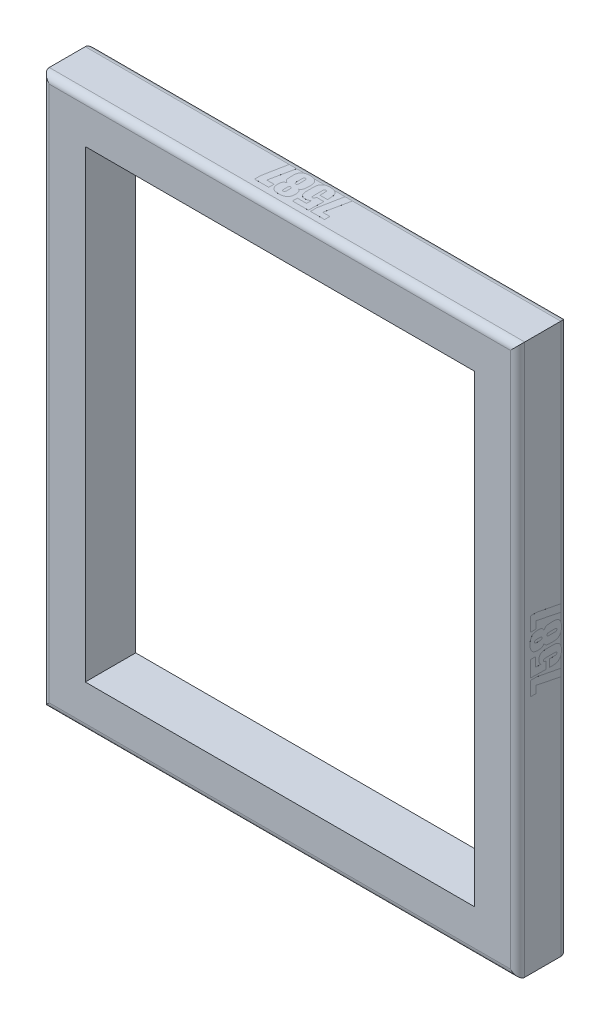
from build123d import *

# Parameters (mm, degrees)
SKETCH1_W           = 838.2
SKETCH1_H           = 969.899
SKETCH1_W_2         = 685.8
SKETCH1_H_2         = 817.499
BOSS_EXTRUDE1_DEPTH = 88.9
FILLET1_R           = 12.7
BOSS_EXTRUDE4_DEPTH = 0.0254
BOSS_EXTRUDE6_DEPTH = 0.0254
BOSS_EXTRUDE7_DEPTH = 0.0254
BOSS_EXTRUDE8_DEPTH = 0.0254


with BuildPart() as part:
    # Sketch1 → Boss-Extrude1 (new body)
    with BuildSketch(Plane.XY):
        with Locations((-393.7, 408.7495)):
            Rectangle(SKETCH1_W, SKETCH1_H)
        with Locations((-393.7, 408.7495)):
            Rectangle(SKETCH1_W_2, SKETCH1_H_2, mode=Mode.SUBTRACT)
    extrude(amount=-BOSS_EXTRUDE1_DEPTH)

    # Fillet1
    fillet1_edges = [part.edges().sort_by_distance(p)[0] for p in [
        (-812.8, 408.7495, -88.9),
        (-393.7, 893.699, -88.9),
        (-393.7, -76.2, -88.9),
        (25.4, 408.7495, -88.9),
        (25.4, 408.7495, 0),
        (-393.7, 893.699, 0),
        (-393.7, -76.2, 0),
        (-812.8, 408.7495, 0),
    ]]
    fillet(fillet1_edges, radius=FILLET1_R)

    # Sketch6 → Boss-Extrude4 (add)
    # profile 1 of 4: a face of its own
    with BuildSketch(Plane.XZ.offset(76.2)):
        Polygon((-424.557304831, -23.212708876), (-424.557304831, -34.277702022), (-432.661243474, -76.2), (-445.752221281, -76.2), (-436.713212795, -32.56340731), (-449.492500654, -32.56340731), (-449.492500654, -23.212708876), align=None)
    # profile 2 of 4: a face of its own
    with BuildSketch(Plane.XZ.offset(76.2)):
        with BuildLine():
            Line((-392.764930157, -23.212708876), (-392.764930157, -31.940027414))
            Line((-392.764930157, -31.940027414), (-408.972807442, -31.940027414))
            Line((-408.972807442, -31.940027414), (-408.972807442, -41.20306305))
            add(Edge.make_bspline(
                [(-408.972807442, -41.20306305), (-408.716075941, -40.911161607), (-408.212989606, -40.339156897), (-407.363386539, -39.59948061), (-406.476983186, -38.950610996), (-405.512639178, -38.449686845), (-404.504537755, -38.047478435), (-403.445088907, -37.748811018), (-402.325275851, -37.585699612), (-401.560929245, -37.562359109), (-401.170818436, -37.550446474)],
                knots=[0, 0, 0, 0, 1.045137506, 2.048032268, 3.025244095, 3.994689253, 4.963425262, 5.942900511, 6.950087905, 8, 8, 8, 8], degree=3))
            add(Edge.make_bspline(
                [(-401.170818436, -37.550446474), (-400.735493166, -37.560572296), (-399.888599593, -37.580271344), (-398.657572322, -37.710161958), (-397.512233318, -37.959944885), (-396.444043319, -38.283288733), (-395.464820631, -38.719671226), (-394.555737601, -39.230451526), (-393.748448308, -39.866074338), (-392.996444401, -40.580764758), (-392.344001839, -41.452215936), (-391.777156258, -42.483166997), (-391.319226704, -43.696673794), (-390.930326196, -45.074712041), (-390.633611279, -46.629495222), (-390.428265475, -48.357810092), (-390.285453474, -50.259181789), (-390.276223598, -51.5859422), (-390.271410574, -52.277796507)],
                knots=[0, 0, 0, 0, 0.985872992, 1.917944025, 2.797562931, 3.637028488, 4.440265023, 5.220874469, 5.991447987, 6.760933446, 7.563799771, 8.445720104, 9.41645382, 10.49401341, 11.685015475, 12.996358654, 14.433717056, 16, 16, 16, 16], degree=3))
            Line((-390.271410574, -52.277796507), (-390.271410574, -59.787576187))
            add(Edge.make_bspline(
                [(-390.271410574, -59.787576187), (-390.274412625, -60.238869043), (-390.280201015, -61.109027139), (-390.292535795, -62.369251199), (-390.345963876, -63.534721041), (-390.4052686, -64.609302477), (-390.464269231, -65.591480595), (-390.568713672, -66.480132886), (-390.669232784, -67.277361296), (-390.83721621, -68.21229513), (-391.121111981, -69.299467562), (-391.615369367, -70.542019338), (-392.263373144, -71.734601638), (-393.057409371, -72.873428682), (-394.015185194, -73.928491163), (-395.159749376, -74.845926401), (-396.46992809, -75.63960778), (-397.94773342, -76.301622987), (-399.599236299, -76.816037958), (-401.420725619, -77.179374827), (-403.411991544, -77.404169059), (-404.796835288, -77.432215352), (-405.514997083, -77.446759791)],
                knots=[0, 0, 0, 0, 0.989754807, 1.908390848, 2.7635747, 3.547977914, 4.268858805, 4.920711554, 5.509810583, 6.030765573, 7.003130656, 7.968352344, 8.956004724, 9.973318671, 11.006457242, 12.069562088, 13.178372901, 14.357538766, 15.611873537, 16.963616047, 18.425371121, 20, 20, 20, 20], degree=3))
            add(Edge.make_bspline(
                [(-405.514997083, -77.446759791), (-406.327771929, -77.423696733), (-407.91162227, -77.378753864), (-410.216221496, -77.047243869), (-412.372770161, -76.481238427), (-414.055266204, -75.823258393), (-415.301939745, -75.184766025), (-416.162224394, -74.651314239), (-416.946222207, -74.048742685), (-417.668176531, -73.401879218), (-418.311404083, -72.690376618), (-418.907222088, -71.942274062), (-419.407130848, -71.118609389), (-419.854704413, -70.238104289), (-420.241278938, -69.268096101), (-420.551258746, -68.181756329), (-420.84022698, -66.981343604), (-421.056402906, -65.652363449), (-421.22959408, -64.202944467), (-421.357283395, -62.633737406), (-421.41949466, -60.943929123), (-421.433270418, -59.777875526), (-421.440405353, -59.173936602)],
                knots=[0, 0, 0, 0, 1.727950145, 3.367247941, 4.937991842, 6.459754912, 7.197724692, 7.914163588, 8.608713051, 9.29788901, 9.972208411, 10.646138941, 11.328189198, 12.016707826, 12.744892405, 13.544369189, 14.416825977, 15.369082158, 16.405235107, 17.52037283, 18.715716525, 20, 20, 20, 20], degree=3))
            Line((-421.440405353, -59.173936602), (-421.440405353, -56.251843342))
            Line((-421.440405353, -56.251843342), (-408.349427546, -56.251843342))
            Line((-408.349427546, -56.251843342), (-408.349427546, -59.641471524))
            add(Edge.make_bspline(
                [(-408.349427546, -59.641471524), (-408.345719237, -60.063543871), (-408.338559332, -60.878469966), (-408.335677154, -62.05402751), (-408.303192341, -63.135195908), (-408.265820669, -64.1191072), (-408.217561517, -65.005613589), (-408.160419045, -65.798151324), (-408.091232831, -66.496217071), (-408.022620618, -67.107009795), (-407.907196172, -67.634534221), (-407.742516196, -68.088113051), (-407.528591411, -68.478355815), (-407.250463986, -68.79894568), (-406.914354786, -69.040832504), (-406.534114093, -69.226510605), (-406.093781561, -69.317704752), (-405.784799631, -69.334159029), (-405.622140503, -69.342821149)],
                knots=[0, 0, 0, 0, 1.823732709, 3.521214749, 5.07892445, 6.496893277, 7.775393918, 8.9147992, 9.929598955, 10.806563962, 11.568882902, 12.256841855, 12.884990135, 13.481481553, 14.073502327, 14.663358483, 15.296344146, 16, 16, 16, 16], degree=3))
            add(Edge.make_bspline(
                [(-405.622140503, -69.342821149), (-405.471912789, -69.335904639), (-405.179568203, -69.322445045), (-404.769249364, -69.202677213), (-404.398989176, -69.013447494), (-404.00415427, -68.652305625), (-403.623800721, -68.127802624), (-403.464829962, -67.549210427), (-403.461420465, -67.089367955), (-403.433295375, -66.687313598), (-403.431066642, -66.134958148), (-403.422013427, -65.433646231), (-403.396035967, -64.583189124), (-403.395169872, -63.582957594), (-403.367261666, -62.437042159), (-403.364076204, -61.622021218), (-403.362388381, -61.190180952)],
                knots=[0, 0, 0, 0, 0.670460052, 1.304721758, 1.895793995, 2.513210904, 3.681360763, 4.748587252, 5.126397419, 5.736946296, 6.550219692, 7.595791071, 8.873918375, 10.355072828, 12.068728984, 14, 14, 14, 14], degree=3))
            Line((-403.362388381, -61.190180952), (-403.362388381, -50.758308012))
            add(Edge.make_bspline(
                [(-403.362388381, -50.758308012), (-403.369593757, -50.303588843), (-403.382793637, -49.470566535), (-403.480077684, -48.338076136), (-403.653498813, -47.438533211), (-403.909653701, -46.745585738), (-404.283061169, -46.249037086), (-404.735862368, -45.884057111), (-405.309527927, -45.690937481), (-405.718252561, -45.667007013), (-405.933830451, -45.654385117)],
                knots=[0, 0, 0, 0, 1.685864163, 3.088417099, 4.207402662, 5.076902269, 5.799120759, 6.485333904, 7.201103886, 8, 8, 8, 8], degree=3))
            add(Edge.make_bspline(
                [(-405.933830451, -45.654385117), (-406.073979291, -45.659095977), (-406.34818563, -45.668312949), (-406.742745462, -45.7669057), (-407.099367581, -45.938230081), (-407.512578844, -46.22605672), (-407.906791866, -46.66636358), (-408.191004879, -47.194645083), (-408.261649994, -47.734734037), (-408.324555601, -48.321253834), (-408.343122206, -49.105777274), (-408.347184064, -49.693453639), (-408.349427546, -50.018044386)],
                knots=[0, 0, 0, 0, 0.735055358, 1.438162732, 2.117072139, 2.803012647, 4.070557493, 5.191645157, 5.884125613, 6.912400264, 8.294628872, 10, 10, 10, 10], degree=3))
            Line((-408.349427546, -50.018044386), (-421.440405353, -50.018044386))
            Line((-421.440405353, -50.018044386), (-420.817025458, -23.212708876))
            Line((-420.817025458, -23.212708876), (-392.764930157, -23.212708876))
        make_face()
    # profile 3 of 4: a face of its own
    with BuildSketch(Plane.XZ.offset(76.2)):
        with BuildLine():
            add(Edge.make_bspline(
                [(-359.852419732, -46.58945496), (-359.413585941, -46.794102682), (-358.549637361, -47.197000345), (-357.39546286, -48.012376105), (-356.410010904, -48.978472514), (-355.683250848, -49.897517746), (-355.211301504, -50.811292425), (-354.922841845, -51.706861748), (-354.675991926, -52.796404663), (-354.461649804, -54.080522928), (-354.316303052, -55.567900372), (-354.201754485, -57.253698057), (-354.119651658, -59.140684774), (-354.11684709, -60.466056129), (-354.115376631, -61.160960019)],
                knots=[0, 0, 0, 0, 1.032863208, 2.033436625, 2.999672589, 3.9748283, 4.520758756, 5.187511175, 5.978195588, 6.906317789, 7.966347498, 9.169082625, 10.515725053, 12, 12, 12, 12], degree=3))
            add(Edge.make_bspline(
                [(-354.115376631, -61.160960019), (-354.118913329, -61.674005032), (-354.125765338, -62.667980084), (-354.183796952, -64.103820002), (-354.280183874, -65.435815896), (-354.413901274, -66.66448171), (-354.589484596, -67.788315856), (-354.788144707, -68.812038252), (-355.04000596, -69.726796939), (-355.336608902, -70.550492599), (-355.67881948, -71.309018255), (-356.10612767, -72.011170672), (-356.590329201, -72.689024305), (-357.163103397, -73.320562442), (-357.798454233, -73.929374639), (-358.509758007, -74.501289288), (-359.293399147, -75.04017453), (-360.149904015, -75.534912741), (-361.083170377, -75.986497091), (-362.091272349, -76.384062017), (-363.176015415, -76.715170959), (-364.336637162, -76.974211096), (-365.568292093, -77.188055959), (-366.878238077, -77.344956513), (-368.263634882, -77.430364051), (-369.212745212, -77.441198853), (-369.69987402, -77.446759791)],
                knots=[0, 0, 0, 0, 1.398583789, 2.709620715, 3.916618244, 5.038718275, 6.077731848, 7.016823425, 7.880065367, 8.661220812, 9.401808779, 10.144087346, 10.898301765, 11.669363034, 12.464435054, 13.295212249, 14.15449737, 15.054744736, 15.988985256, 16.978448116, 18.005975078, 19.077395418, 20.218224661, 21.412695174, 22.672071436, 24, 24, 24, 24], degree=3))
            add(Edge.make_bspline(
                [(-369.69987402, -77.446759791), (-370.174053488, -77.441503254), (-371.097287346, -77.431268704), (-372.442939675, -77.341861974), (-373.711540433, -77.199808417), (-374.90324735, -76.99043543), (-376.026654445, -76.747615488), (-377.067721564, -76.419394986), (-378.040941239, -76.05687962), (-378.929154093, -75.612817835), (-379.746802265, -75.12200953), (-380.511555813, -74.606583761), (-381.21872322, -74.050674339), (-381.854509737, -73.448412652), (-382.44011409, -72.816393903), (-382.966907106, -72.148745446), (-383.420749146, -71.432964934), (-383.837433143, -70.678366318), (-384.17778712, -69.829695849), (-384.479506255, -68.873086589), (-384.729266825, -67.788127109), (-384.928078531, -66.577220491), (-385.095526807, -65.238877596), (-385.207292915, -63.772964785), (-385.276614981, -62.181130169), (-385.281721388, -61.079869578), (-385.28437141, -60.508359191)],
                knots=[0, 0, 0, 0, 1.268974087, 2.470709768, 3.607874871, 4.683617739, 5.708163252, 6.681184595, 7.602668945, 8.484841014, 9.334307608, 10.153776327, 10.951769698, 11.738661753, 12.495071084, 13.256455536, 14.010915677, 14.761311323, 15.560108623, 16.453296839, 17.443968622, 18.536843119, 19.736471951, 21.052764021, 22.470501904, 24, 24, 24, 24], degree=3))
            add(Edge.make_bspline(
                [(-385.28437141, -60.508359191), (-385.279226346, -59.738645817), (-385.269274631, -58.249846521), (-385.127250324, -56.095256859), (-384.914612793, -54.09961998), (-384.680984729, -52.531610578), (-384.386535104, -51.36034273), (-384.072855162, -50.540142343), (-383.672745539, -49.762291945), (-383.168243412, -49.035614416), (-382.569679368, -48.353894585), (-381.88604633, -47.710146664), (-381.112277467, -47.108489834), (-380.5414724, -46.765447118), (-380.248630691, -46.58945496)],
                knots=[0, 0, 0, 0, 1.76788096, 3.419480574, 4.957221844, 6.378326448, 7.056708483, 7.727130868, 8.390966019, 9.061263932, 9.753766915, 10.471320765, 11.215737443, 12, 12, 12, 12], degree=3))
            add(Edge.make_bspline(
                [(-380.248630691, -46.58945496), (-380.651031886, -46.373423135), (-381.450099441, -45.944438271), (-382.480993805, -45.042456456), (-383.358632205, -43.976346239), (-384.078496451, -42.730124608), (-384.613840443, -41.298912841), (-385.015356892, -39.699046673), (-385.243029842, -37.920597805), (-385.270221799, -36.677708203), (-385.28437141, -36.030957979)],
                knots=[0, 0, 0, 0, 0.883452064, 1.754313577, 2.635585967, 3.552582121, 4.531408869, 5.589827807, 6.745842426, 8, 8, 8, 8], degree=3))
            add(Edge.make_bspline(
                [(-385.28437141, -36.030957979), (-385.274954736, -35.462195026), (-385.256712902, -34.360396344), (-385.064632528, -32.761034378), (-384.768367242, -31.270623142), (-384.354528958, -29.885805214), (-383.799926612, -28.619081076), (-383.143173544, -27.450393201), (-382.343545324, -26.402041154), (-381.431215136, -25.456629554), (-380.393134099, -24.626176928), (-379.232337507, -23.913095828), (-377.957831386, -23.309201617), (-376.565956083, -22.809058021), (-375.05025833, -22.436201844), (-373.418785741, -22.166298974), (-371.667636814, -21.998721399), (-370.460005355, -21.977111204), (-369.836238372, -21.965949085)],
                knots=[0, 0, 0, 0, 1.139402086, 2.207231867, 3.22303984, 4.18224988, 5.097340406, 5.98918555, 6.862439802, 7.732171629, 8.616292135, 9.519178424, 10.456373729, 11.438161639, 12.478190297, 13.58003508, 14.750037352, 16, 16, 16, 16], degree=3))
            add(Edge.make_bspline(
                [(-369.836238372, -21.965949085), (-369.121552229, -21.976152166), (-367.748298999, -21.995757157), (-365.772776293, -22.17235312), (-363.967440118, -22.457355795), (-362.332328938, -22.86237432), (-360.869409943, -23.384193826), (-359.579157079, -24.029851148), (-358.453701508, -24.788153544), (-357.506077666, -25.683184673), (-356.704050268, -26.681096088), (-356.007504737, -27.768477757), (-355.422798653, -28.959641298), (-354.933330521, -30.245907568), (-354.566759264, -31.637792434), (-354.310244148, -33.124115808), (-354.135389151, -34.708627918), (-354.122180914, -35.79993614), (-354.115376631, -36.362128548)],
                knots=[0, 0, 0, 0, 1.390282688, 2.671396681, 3.855329736, 4.943140366, 5.94429892, 6.870936351, 7.743522199, 8.574793464, 9.396625976, 10.229000645, 11.082185822, 11.973862168, 12.902457006, 13.877689888, 14.906682267, 16, 16, 16, 16], degree=3))
            add(Edge.make_bspline(
                [(-354.115376631, -36.362128548), (-354.119847695, -36.716069238), (-354.128507009, -37.401562372), (-354.173828378, -38.389707737), (-354.260571453, -39.303374453), (-354.386509067, -40.135369978), (-354.540447374, -40.894415369), (-354.73168902, -41.576659915), (-354.965996945, -42.181958593), (-355.32561953, -42.913806345), (-355.970708581, -43.768744031), (-356.998060665, -44.731094828), (-358.307217861, -45.699111995), (-359.313178246, -46.278744837), (-359.852419732, -46.58945496)],
                knots=[0, 0, 0, 0, 1.011071591, 1.958188627, 2.824730267, 3.631383318, 4.36076049, 5.035941548, 5.65252725, 6.212453826, 7.360711157, 8.68567436, 10.223367527, 12, 12, 12, 12], degree=3))
        make_face()
        with BuildLine():
            add(Edge.make_bspline(
                [(-367.206354438, -34.638093525), (-367.210167817, -34.215848653), (-367.217132739, -33.444642203), (-367.306783048, -32.403735528), (-367.459974611, -31.592436044), (-367.687118088, -30.98155937), (-368.039725522, -30.551996084), (-368.501562921, -30.259006447), (-369.086029545, -30.099881266), (-369.510603455, -30.080373971), (-369.738835264, -30.069887727)],
                knots=[0, 0, 0, 0, 1.677591877, 3.064026972, 4.144413779, 4.954209473, 5.623204291, 6.313866106, 7.09361037, 8, 8, 8, 8], degree=3))
            add(Edge.make_bspline(
                [(-369.738835264, -30.069887727), (-369.961246616, -30.07813553), (-370.376326953, -30.093528182), (-370.942528621, -30.282381675), (-371.395716553, -30.593032725), (-371.728406796, -31.052628019), (-371.94636359, -31.675067746), (-372.08729225, -32.479940593), (-372.184198585, -33.489713219), (-372.190141764, -34.231966187), (-372.193393603, -34.638093525)],
                knots=[0, 0, 0, 0, 0.893586732, 1.667676933, 2.372236962, 3.073872481, 3.915008431, 5.008641075, 6.36326335, 8, 8, 8, 8], degree=3))
            Line((-372.193393603, -34.638093525), (-372.193393603, -38.797206265))
            add(Edge.make_bspline(
                [(-372.193393603, -38.797206265), (-372.186522435, -39.177380053), (-372.173863169, -39.877802598), (-372.071112553, -40.83397162), (-371.909639832, -41.605461104), (-371.658880933, -42.206501342), (-371.29391583, -42.642542693), (-370.840238482, -42.959242866), (-370.276306962, -43.131031073), (-369.873035797, -43.150581758), (-369.660912777, -43.160865534)],
                knots=[0, 0, 0, 0, 1.580112676, 2.911159526, 3.99162225, 4.849527291, 5.587451052, 6.3250044, 7.118942395, 8, 8, 8, 8], degree=3))
            add(Edge.make_bspline(
                [(-369.660912777, -43.160865534), (-369.438580836, -43.151914515), (-369.024670316, -43.135250598), (-368.461950208, -42.956797327), (-368.002357605, -42.668595802), (-367.666903773, -42.212621467), (-367.450897438, -41.575176113), (-367.310801006, -40.727966927), (-367.21522748, -39.640204651), (-367.209508394, -38.83317384), (-367.206354438, -38.388113209)],
                knots=[0, 0, 0, 0, 0.861738235, 1.604279261, 2.26950699, 2.936050938, 3.759007418, 4.863263716, 6.270155474, 8, 8, 8, 8], degree=3))
            Line((-367.206354438, -38.388113209), (-367.206354438, -34.638093525))
        make_face(mode=Mode.SUBTRACT)
        with BuildLine():
            add(Edge.make_bspline(
                [(-367.206354438, -56.972626346), (-367.211748628, -56.504657885), (-367.221584142, -55.651386075), (-367.337433584, -54.501977875), (-367.499096936, -53.596117351), (-367.775560823, -52.922809224), (-368.143206249, -52.439210606), (-368.607226602, -52.115529202), (-369.15774369, -51.911559219), (-369.558358338, -51.896215562), (-369.768056196, -51.888184072)],
                knots=[0, 0, 0, 0, 1.738659472, 3.170190386, 4.292187352, 5.146388336, 5.851388248, 6.517831636, 7.224173325, 8, 8, 8, 8], degree=3))
            add(Edge.make_bspline(
                [(-369.768056196, -51.888184072), (-369.97116903, -51.896599966), (-370.35480661, -51.912495824), (-370.883148731, -52.107330947), (-371.321330113, -52.420202549), (-371.677922238, -52.884607234), (-371.912710819, -53.557212561), (-372.075614559, -54.458975986), (-372.173942067, -55.6264714), (-372.186494539, -56.495172595), (-372.193393603, -56.972626346)],
                knots=[0, 0, 0, 0, 0.760444209, 1.436319754, 2.083469305, 2.762315263, 3.601134717, 4.733605304, 6.204730916, 8, 8, 8, 8], degree=3))
            Line((-372.193393603, -56.972626346), (-372.193393603, -63.897987373))
            add(Edge.make_bspline(
                [(-372.193393603, -63.897987373), (-372.191737262, -64.173996507), (-372.188579438, -64.700209827), (-372.159328024, -65.450525857), (-372.113123307, -66.123390099), (-372.043258696, -66.720891139), (-371.965870154, -67.244546297), (-371.840721114, -67.686884709), (-371.725336992, -68.057860706), (-371.530595153, -68.435558786), (-371.218349229, -68.805624502), (-370.749595124, -69.123064419), (-370.18832195, -69.318121442), (-369.785972323, -69.334278767), (-369.573249979, -69.342821149)],
                knots=[0, 0, 0, 0, 1.447752538, 2.760150215, 3.93838463, 4.984106116, 5.916477053, 6.709663222, 7.393673362, 7.949736311, 8.928845415, 9.89723076, 10.888265397, 12, 12, 12, 12], degree=3))
            add(Edge.make_bspline(
                [(-369.573249979, -69.342821149), (-369.357037119, -69.335561668), (-368.952954179, -69.321994332), (-368.405391908, -69.119990806), (-367.969939686, -68.794225036), (-367.711683355, -68.410738316), (-367.562786825, -68.027964827), (-367.467603375, -67.654896532), (-367.397279721, -67.200599882), (-367.311452571, -66.673174845), (-367.273077674, -66.063790055), (-367.228778199, -65.379113387), (-367.214653339, -64.615555538), (-367.20919766, -64.079795235), (-367.206354438, -63.800584265)],
                knots=[0, 0, 0, 0, 1.132013677, 2.115634625, 3.017552291, 3.950947162, 4.502860332, 5.17404829, 5.971581461, 6.920938255, 7.983416076, 9.181056498, 10.530910287, 12, 12, 12, 12], degree=3))
            Line((-367.206354438, -63.800584265), (-367.206354438, -56.972626346))
        make_face(mode=Mode.SUBTRACT)
    # profile 4 of 4: a face of its own
    with BuildSketch(Plane.XZ.offset(76.2)):
        Polygon((-326.06328133, -23.212708876), (-326.06328133, -34.277702022), (-334.167219972, -76.2), (-347.258197779, -76.2), (-338.219189294, -32.56340731), (-350.998477153, -32.56340731), (-350.998477153, -23.212708876), align=None)
    extrude(amount=BOSS_EXTRUDE4_DEPTH)

    # Sketch9 → Boss-Extrude6 (add)
    # profile 1 of 4: a face of its own
    with BuildSketch(Plane(origin=(0, 893.699, 0), x_dir=(1, 0, 0), z_dir=(0, 1, 0))):
        Polygon((-362.842695169, 23.212708876), (-362.842695169, 34.277702022), (-354.738756526, 76.2), (-341.647778719, 76.2), (-350.686787205, 32.56340731), (-337.907499346, 32.56340731), (-337.907499346, 23.212708876), align=None)
    # profile 2 of 4: a face of its own
    with BuildSketch(Plane(origin=(0, 893.699, 0), x_dir=(1, 0, 0), z_dir=(0, 1, 0))):
        with BuildLine():
            Line((-394.635069843, 23.212708876), (-394.635069843, 31.940027414))
            Line((-394.635069843, 31.940027414), (-378.427192558, 31.940027414))
            Line((-378.427192558, 31.940027414), (-378.427192558, 41.20306305))
            add(Edge.make_bspline(
                [(-378.427192558, 41.20306305), (-378.683924059, 40.911161607), (-379.187010395, 40.339156897), (-380.036613461, 39.59948061), (-380.923016814, 38.950610996), (-381.887360822, 38.449686845), (-382.895462245, 38.047478435), (-383.954911093, 37.748811018), (-385.074724149, 37.585699612), (-385.839070755, 37.562359109), (-386.229181564, 37.550446474)],
                knots=[0, 0, 0, 0, 1.045137506, 2.048032268, 3.025244095, 3.994689253, 4.963425262, 5.942900511, 6.950087905, 8, 8, 8, 8], degree=3))
            add(Edge.make_bspline(
                [(-386.229181564, 37.550446474), (-386.664733125, 37.558999433), (-387.512438267, 37.575645882), (-388.740064019, 37.727141616), (-389.886847352, 37.953623248), (-390.950227936, 38.289704751), (-391.936768455, 38.713866841), (-392.837838177, 39.24351223), (-393.655196602, 39.864324093), (-394.402935363, 40.581638), (-395.056185322, 41.451952428), (-395.622785968, 42.483248337), (-396.080791315, 43.696648425), (-396.469668192, 45.074719943), (-396.766390459, 46.629492776), (-396.971733993, 48.357810842), (-397.114546678, 50.259181574), (-397.123776454, 51.585942126), (-397.128589426, 52.277796507)],
                knots=[0, 0, 0, 0, 0.985978896, 1.918990669, 2.797197047, 3.629736286, 4.43979477, 5.224184376, 5.990372855, 6.759940973, 7.562893544, 8.444908613, 9.415746607, 10.49342195, 11.684551954, 12.996035999, 14.433548803, 16, 16, 16, 16], degree=3))
            Line((-397.128589426, 52.277796507), (-397.128589426, 59.787576187))
            add(Edge.make_bspline(
                [(-397.128589426, 59.787576187), (-397.125576323, 60.238867878), (-397.119766624, 61.109023726), (-397.107579484, 62.369263354), (-397.053649962, 63.534680324), (-396.995999522, 64.609436191), (-396.931605467, 65.590706865), (-396.844987655, 66.477663458), (-396.738935959, 67.270684447), (-396.572878828, 68.202549632), (-396.288719666, 69.294295949), (-395.787174644, 70.535574688), (-395.134547146, 71.727063054), (-394.339654162, 72.864172872), (-393.388366312, 73.928509909), (-392.239787429, 74.845548167), (-390.930166593, 75.639504169), (-389.452404029, 76.302530694), (-387.799412274, 76.812349409), (-385.981392505, 77.195841231), (-383.987041568, 77.399548484), (-382.602956069, 77.430634728), (-381.885002917, 77.446759791)],
                knots=[0, 0, 0, 0, 0.98969914, 1.908283515, 2.763419269, 3.547778367, 4.268618713, 4.919695537, 5.50170546, 6.022631151, 6.994941545, 7.969361217, 8.950701588, 9.967958318, 11.006300459, 12.069345513, 13.178093963, 14.357193509, 15.611457733, 16.964567375, 18.425459682, 20, 20, 20, 20], degree=3))
            add(Edge.make_bspline(
                [(-381.885002917, 77.446759791), (-381.072363855, 77.423078257), (-379.485564616, 77.376836523), (-377.178210921, 77.053246545), (-375.026070383, 76.466634058), (-373.344900459, 75.813624192), (-372.097592311, 75.175579205), (-371.241224027, 74.640294678), (-370.450421278, 74.049843494), (-369.732895798, 73.400801245), (-369.087554816, 72.69375941), (-368.503663225, 71.938839689), (-368.002239201, 71.119018468), (-367.554284741, 70.238230093), (-367.171891345, 69.266179999), (-366.841772591, 68.185286601), (-366.577230426, 66.978345715), (-366.338372639, 65.653936181), (-366.171993171, 64.202637299), (-366.042246286, 62.633828423), (-365.980636829, 60.943903677), (-365.966774447, 59.777866844), (-365.959594647, 59.173936602)],
                knots=[0, 0, 0, 0, 1.728367873, 3.374896622, 4.941126004, 6.463256957, 7.201405138, 7.918017232, 8.608569322, 9.297911888, 9.972394304, 10.642265426, 11.324480566, 12.013165642, 12.741526258, 13.543191508, 14.414300458, 15.367962646, 16.404366083, 17.519773387, 18.715406053, 20, 20, 20, 20], degree=3))
            Line((-365.959594647, 59.173936602), (-365.959594647, 56.251843342))
            Line((-365.959594647, 56.251843342), (-379.050572454, 56.251843342))
            Line((-379.050572454, 56.251843342), (-379.050572454, 59.641471524))
            add(Edge.make_bspline(
                [(-379.050572454, 59.641471524), (-379.05428457, 60.063543486), (-379.061451825, 60.878468837), (-379.064283197, 62.054031522), (-379.096937965, 63.135182722), (-379.133758024, 64.119149833), (-379.183780165, 65.005477822), (-379.23517529, 65.795692915), (-379.321089629, 66.489160407), (-379.389494326, 67.09618337), (-379.493259529, 67.627891496), (-379.652765125, 68.089381726), (-379.883710251, 68.47195165), (-380.148455299, 68.80243365), (-380.486395026, 69.040233336), (-380.86567062, 69.226682639), (-381.306281084, 69.317654693), (-381.615221974, 69.334141765), (-381.777859497, 69.342821149)],
                knots=[0, 0, 0, 0, 1.824236655, 3.522187753, 5.080327891, 6.49868854, 7.777542464, 8.917262594, 9.919851397, 10.797058732, 11.556612963, 12.257940989, 12.893274711, 13.48078562, 14.072969985, 14.662989134, 15.296149708, 16, 16, 16, 16], degree=3))
            add(Edge.make_bspline(
                [(-381.777859497, 69.342821149), (-381.928026284, 69.335800998), (-382.220252306, 69.322139717), (-382.635666084, 69.202563038), (-383.006351175, 69.004930161), (-383.406012715, 68.645593198), (-383.774204552, 68.114351447), (-383.935450278, 67.539623534), (-383.938382646, 67.082828558), (-383.967268141, 66.680859635), (-383.968615873, 66.131696816), (-383.978210849, 65.430406488), (-384.003921278, 64.583187234), (-384.004844304, 63.58295822), (-384.03273402, 62.437041969), (-384.035922302, 61.622021152), (-384.037611619, 61.190180952)],
                knots=[0, 0, 0, 0, 0.670608384, 1.305010414, 1.915867048, 2.533420554, 3.693585531, 4.761048132, 5.138941885, 5.735119042, 6.563093728, 7.594374212, 8.872784286, 10.354266428, 12.068301712, 14, 14, 14, 14], degree=3))
            Line((-384.037611619, 61.190180952), (-384.037611619, 50.758308012))
            add(Edge.make_bspline(
                [(-384.037611619, 50.758308012), (-384.03071449, 50.303529465), (-384.018128325, 49.473630846), (-383.917714463, 48.341847455), (-383.74832791, 47.441037791), (-383.489519493, 46.746707725), (-383.120379011, 46.247329875), (-382.658570596, 45.897557313), (-382.093264415, 45.687163837), (-381.682325076, 45.665683729), (-381.466169549, 45.654385117)],
                knots=[0, 0, 0, 0, 1.686577367, 3.07773583, 4.208985325, 5.078852773, 5.801376797, 6.48055365, 7.200765913, 8, 8, 8, 8], degree=3))
            add(Edge.make_bspline(
                [(-381.466169549, 45.654385117), (-381.325983314, 45.659048286), (-381.05170381, 45.668171948), (-380.657668453, 45.76743358), (-380.301544405, 45.935178652), (-379.89737939, 46.233622598), (-379.490871254, 46.657195191), (-379.222012538, 47.19426346), (-379.134646609, 47.730043727), (-379.07717666, 48.321647914), (-379.056260344, 49.105636808), (-379.052596243, 49.69340366), (-379.050572454, 50.018044386)],
                knots=[0, 0, 0, 0, 0.735446102, 1.438927237, 2.118197541, 2.790575895, 4.070333913, 5.169206575, 5.881937678, 6.910758944, 8.293722323, 10, 10, 10, 10], degree=3))
            Line((-379.050572454, 50.018044386), (-365.959594647, 50.018044386))
            Line((-365.959594647, 50.018044386), (-366.582974542, 23.212708876))
            Line((-366.582974542, 23.212708876), (-394.635069843, 23.212708876))
        make_face()
    # profile 3 of 4: a face of its own
    with BuildSketch(Plane(origin=(0, 893.699, 0), x_dir=(1, 0, 0), z_dir=(0, 1, 0))):
        with BuildLine():
            add(Edge.make_bspline(
                [(-427.547580268, 46.58945496), (-427.986990482, 46.793342558), (-428.849663924, 47.193625505), (-429.995730026, 48.018994395), (-430.990498094, 48.974477537), (-431.716474884, 49.89781767), (-432.188767394, 50.811217082), (-432.477134144, 51.706888006), (-432.724016265, 52.796395706), (-432.938347496, 54.080525882), (-433.083697823, 55.567899415), (-433.198245237, 57.253698361), (-433.280348423, 59.140684685), (-433.283152938, 60.466056098), (-433.284623369, 61.160960019)],
                knots=[0, 0, 0, 0, 1.032921266, 2.027885824, 2.999166675, 3.9743772, 4.520338343, 5.187128241, 5.977857099, 6.90603147, 7.966120764, 9.168923498, 10.515641621, 12, 12, 12, 12], degree=3))
            add(Edge.make_bspline(
                [(-433.284623369, 61.160960019), (-433.281123898, 61.674011343), (-433.274344012, 62.667998621), (-433.215810724, 64.103753497), (-433.121120767, 65.436037053), (-432.982152337, 66.660068861), (-432.82542826, 67.787231478), (-432.607919945, 68.803110881), (-432.371287478, 69.721520111), (-432.072609699, 70.540718455), (-431.730407785, 71.298797536), (-431.305220002, 72.005058792), (-430.805437438, 72.676614485), (-430.240662369, 73.320390073), (-429.604040555, 73.929550059), (-428.886874625, 74.490420647), (-428.107465223, 75.031890858), (-427.247095976, 75.522260004), (-426.321837432, 75.991269993), (-425.30610021, 76.371379158), (-424.223010029, 76.703594269), (-423.064791914, 76.97736141), (-421.831505104, 77.187110482), (-420.521820299, 77.345228662), (-419.136349255, 77.430290097), (-418.187249408, 77.44117377), (-417.70012598, 77.446759791)],
                knots=[0, 0, 0, 0, 1.398670318, 2.709788357, 3.916860561, 5.039030015, 6.068030165, 7.017633598, 7.870060263, 8.651264037, 9.391897823, 10.134222314, 10.893711138, 11.671447011, 12.466568221, 13.291861523, 14.151199807, 15.051502871, 15.989692636, 16.976004672, 18.003595206, 19.077090862, 20.217990687, 21.4125351, 22.671989278, 24, 24, 24, 24], degree=3))
            add(Edge.make_bspline(
                [(-417.70012598, 77.446759791), (-417.225960764, 77.441440315), (-416.302754656, 77.431083223), (-414.956906161, 77.342542768), (-413.685811449, 77.197094527), (-412.49101068, 76.997805113), (-411.374218132, 76.729077333), (-410.328003018, 76.425779607), (-409.360970334, 76.04465469), (-408.47400997, 75.6014242), (-407.647286051, 75.124773777), (-406.891308939, 74.595625904), (-406.184557434, 74.040875162), (-405.539619944, 73.447874403), (-404.962091325, 72.81003024), (-404.447149341, 72.137059098), (-403.981899855, 71.430605924), (-403.577897901, 70.667703651), (-403.218522937, 69.822961986), (-402.921646557, 68.862798154), (-402.671620197, 67.781594079), (-402.470017332, 66.570974697), (-402.306041795, 65.235462509), (-402.192006288, 63.769783394), (-402.123543026, 62.18111528), (-402.118332596, 61.079864491), (-402.11562859, 60.508359191)],
                knots=[0, 0, 0, 0, 1.269319951, 2.471383168, 3.608858211, 4.693461438, 5.711777896, 6.682538286, 7.607424193, 8.489836701, 9.335121931, 10.159730496, 10.957941363, 11.739122284, 12.502151362, 13.258417275, 14.005789475, 14.764050817, 15.566415619, 16.459847276, 17.450789071, 18.535392298, 19.743974549, 21.051960741, 22.470085034, 24, 24, 24, 24], degree=3))
            add(Edge.make_bspline(
                [(-402.11562859, 60.508359191), (-402.120712632, 59.738628395), (-402.130546315, 58.249795401), (-402.273392408, 56.09544036), (-402.483562755, 54.095816626), (-402.725686177, 52.52772437), (-402.999734111, 51.351902974), (-403.318607636, 50.535315393), (-403.728268693, 49.764467729), (-404.231725837, 49.038547102), (-404.820427158, 48.351040994), (-405.505477204, 47.707341309), (-406.286714339, 47.111452176), (-406.858933879, 46.765999924), (-407.151369309, 46.58945496)],
                knots=[0, 0, 0, 0, 1.76743082, 3.4186099, 4.955959628, 6.384060007, 7.060422276, 7.723711305, 8.390845036, 9.060972277, 9.748423191, 10.465794336, 11.215937134, 12, 12, 12, 12], degree=3))
            add(Edge.make_bspline(
                [(-407.151369309, 46.58945496), (-406.749107533, 46.373294959), (-405.95031683, 45.944055568), (-404.918924912, 45.045332418), (-404.048416822, 43.971639631), (-403.335571922, 42.720387901), (-402.784562932, 41.294554018), (-402.384299192, 39.695738942), (-402.156953924, 37.920648359), (-402.129772645, 36.677725506), (-402.11562859, 36.030957979)],
                knots=[0, 0, 0, 0, 0.883712392, 1.754830524, 2.632370122, 3.555092285, 4.536494435, 5.589117597, 6.745472861, 8, 8, 8, 8], degree=3))
            add(Edge.make_bspline(
                [(-402.11562859, 36.030957979), (-402.125039176, 35.462191476), (-402.143269215, 34.360385919), (-402.335432458, 32.761072262), (-402.631407202, 31.270491651), (-403.04624714, 29.886257651), (-403.597995521, 28.616003756), (-404.268338251, 27.453339285), (-405.0651422, 26.401199185), (-405.978266383, 25.460195781), (-407.007471915, 24.622951334), (-408.168100429, 23.913631377), (-409.442043357, 23.309048441), (-410.834080326, 22.809102544), (-412.349731041, 22.436188847), (-413.981217357, 22.166302762), (-415.73236233, 21.998720351), (-416.939994353, 21.977110847), (-417.563761628, 21.965949085)],
                knots=[0, 0, 0, 0, 1.139531766, 2.207483082, 3.223406667, 4.182725879, 5.097920555, 5.993113803, 6.866467443, 7.736298258, 8.615451765, 9.518440815, 10.455742786, 11.437642437, 12.477789465, 13.579759654, 14.749895088, 16, 16, 16, 16], degree=3))
            add(Edge.make_bspline(
                [(-417.563761628, 21.965949085), (-418.278441467, 21.976164832), (-419.651682584, 21.995794158), (-421.627288578, 22.172222789), (-423.432344141, 22.457789231), (-425.068381472, 22.860947063), (-426.529615248, 23.38940932), (-427.83132124, 24.01537321), (-428.955546995, 24.779388045), (-429.90382309, 25.673169869), (-430.705523855, 26.671511764), (-431.404326954, 27.760836193), (-431.986858643, 28.95553096), (-432.464161962, 30.24800911), (-432.834045106, 31.637505808), (-433.089523895, 33.124198463), (-433.264674462, 34.708605251), (-433.277840714, 35.799928433), (-433.284623369, 36.362128548)],
                knots=[0, 0, 0, 0, 1.389736868, 2.670347902, 3.853816149, 4.941199709, 5.941965212, 6.871075703, 7.743318977, 8.574263888, 9.395773752, 10.227821635, 11.086333741, 11.975442813, 12.903673089, 13.878523099, 14.907111499, 16, 16, 16, 16], degree=3))
            add(Edge.make_bspline(
                [(-433.284623369, 36.362128548), (-433.280155089, 36.716070299), (-433.271501165, 37.401565488), (-433.22614239, 38.389696594), (-433.139525135, 39.303411271), (-433.013170399, 40.135247796), (-432.860591358, 40.894811314), (-432.665189774, 41.574242082), (-432.44599994, 42.184063401), (-432.082407171, 42.913052792), (-431.439611055, 43.772317917), (-430.401529958, 44.727423013), (-429.093502254, 45.699823594), (-428.087073059, 46.278993169), (-427.547580268, 46.58945496)],
                knots=[0, 0, 0, 0, 1.010783938, 1.957631517, 2.823926623, 3.630350179, 4.359519841, 5.034508808, 5.647633035, 6.207400311, 7.355330959, 8.686617295, 10.223872985, 12, 12, 12, 12], degree=3))
        make_face()
        with BuildLine():
            add(Edge.make_bspline(
                [(-420.193645562, 34.638093525), (-420.191877841, 34.215582055), (-420.188647871, 33.443571358), (-420.0763508, 32.405939066), (-419.942824917, 31.591105082), (-419.712059515, 30.982126522), (-419.359487835, 30.548371769), (-418.892579146, 30.264059331), (-418.311634748, 30.097768878), (-417.889670388, 30.079682184), (-417.661164736, 30.069887727)],
                knots=[0, 0, 0, 0, 1.67817453, 3.066351525, 4.144567779, 4.954644728, 5.623871898, 6.325656485, 7.093295567, 8, 8, 8, 8], degree=3))
            add(Edge.make_bspline(
                [(-417.661164736, 30.069887727), (-417.438753384, 30.07813553), (-417.023673047, 30.093528182), (-416.457471379, 30.282381675), (-416.004283447, 30.593032725), (-415.671593204, 31.052628019), (-415.45363641, 31.675067746), (-415.31270775, 32.479940593), (-415.215801415, 33.489713219), (-415.209858237, 34.231966187), (-415.206606397, 34.638093525)],
                knots=[0, 0, 0, 0, 0.893586732, 1.667676933, 2.372236962, 3.073872481, 3.915008431, 5.008641075, 6.36326335, 8, 8, 8, 8], degree=3))
            Line((-415.206606397, 34.638093525), (-415.206606397, 38.797206265))
            add(Edge.make_bspline(
                [(-415.206606397, 38.797206265), (-415.213979709, 39.177254712), (-415.22756411, 39.877446334), (-415.324647788, 40.835796035), (-415.502521128, 41.60397501), (-415.750012123, 42.207092623), (-416.115228532, 42.638970663), (-416.560923165, 42.962079017), (-417.124110446, 43.130432183), (-417.527108081, 43.150375324), (-417.739087223, 43.160865534)],
                knots=[0, 0, 0, 0, 1.581686452, 2.914059012, 3.998715793, 4.857475299, 5.596134024, 6.323336121, 7.11806487, 8, 8, 8, 8], degree=3))
            add(Edge.make_bspline(
                [(-417.739087223, 43.160865534), (-417.961236379, 43.151638384), (-418.374806614, 43.134460399), (-418.941483707, 42.958799092), (-419.394987895, 42.657857744), (-419.731136326, 42.205965833), (-419.951252586, 41.572537406), (-420.088553856, 40.727826675), (-420.184997371, 39.640253533), (-420.19057153, 38.833191215), (-420.193645562, 38.388113209)],
                knots=[0, 0, 0, 0, 0.862252359, 1.605236396, 2.277894759, 2.944836376, 3.756477184, 4.861392296, 6.269123425, 8, 8, 8, 8], degree=3))
            Line((-420.193645562, 38.388113209), (-420.193645562, 34.638093525))
        make_face(mode=Mode.SUBTRACT)
        with BuildLine():
            add(Edge.make_bspline(
                [(-420.193645562, 56.972626346), (-420.188344473, 56.504654271), (-420.178678716, 55.651375871), (-420.061480103, 54.498843104), (-419.901703869, 53.589764775), (-419.627314083, 52.91422214), (-419.252736109, 52.434958975), (-418.78685958, 52.120677835), (-418.239972162, 51.909489947), (-417.841910448, 51.895541497), (-417.631943804, 51.888184072)],
                knots=[0, 0, 0, 0, 1.738465186, 3.169836134, 4.30352368, 5.157629211, 5.853086489, 6.529326469, 7.224260019, 8, 8, 8, 8], degree=3))
            add(Edge.make_bspline(
                [(-417.631943804, 51.888184072), (-417.428833852, 51.89660049), (-417.045201716, 51.91249734), (-416.516822748, 52.107325752), (-416.078774272, 52.420221562), (-415.721624824, 52.884524738), (-415.488488995, 53.561314211), (-415.30959421, 54.460493806), (-415.231043413, 55.63057748), (-415.215296423, 56.49538155), (-415.206606397, 56.972626346)],
                knots=[0, 0, 0, 0, 0.760334389, 1.436112327, 2.083168419, 2.761916342, 3.600614657, 4.747304927, 6.204990181, 8, 8, 8, 8], degree=3))
            Line((-415.206606397, 56.972626346), (-415.206606397, 63.897987373))
            add(Edge.make_bspline(
                [(-415.206606397, 63.897987373), (-415.208275466, 64.173993794), (-415.211457558, 64.700201943), (-415.240545553, 65.450552798), (-415.287278489, 66.123304474), (-415.355119892, 66.717978074), (-415.437456274, 67.240494124), (-415.555408293, 67.681557959), (-415.676743767, 68.0507186), (-415.871018007, 68.427582499), (-416.177386531, 68.801691016), (-416.644674247, 69.128028236), (-417.209302792, 69.316124128), (-417.61427127, 69.333634048), (-417.826750021, 69.342821149)],
                knots=[0, 0, 0, 0, 1.447902143, 2.760435437, 3.938791605, 4.984621151, 5.900291505, 6.710029377, 7.378016976, 7.934137386, 8.926444606, 9.880898724, 10.888150515, 12, 12, 12, 12], degree=3))
            add(Edge.make_bspline(
                [(-417.826750021, 69.342821149), (-418.043009026, 69.335591671), (-418.447178204, 69.32208041), (-418.994173828, 69.119708441), (-419.433756997, 68.793579522), (-419.686232708, 68.402796936), (-419.837610167, 68.018419553), (-419.931646372, 67.645010218), (-420.005354772, 67.194900361), (-420.072617242, 66.668487644), (-420.132083989, 66.064592094), (-420.169570271, 65.378948947), (-420.185824617, 64.615603127), (-420.190966089, 64.079811539), (-420.193645562, 63.800584265)],
                knots=[0, 0, 0, 0, 1.132355695, 2.116273827, 3.018463991, 3.966261256, 4.518341177, 5.189731923, 5.987506054, 6.91789395, 7.982202537, 9.180204804, 10.530466427, 12, 12, 12, 12], degree=3))
            Line((-420.193645562, 63.800584265), (-420.193645562, 56.972626346))
        make_face(mode=Mode.SUBTRACT)
    # profile 4 of 4: a face of its own
    with BuildSketch(Plane(origin=(0, 893.699, 0), x_dir=(1, 0, 0), z_dir=(0, 1, 0))):
        Polygon((-461.33671867, 23.212708876), (-461.33671867, 34.277702022), (-453.232780028, 76.2), (-440.141802221, 76.2), (-449.180810706, 32.56340731), (-436.401522847, 32.56340731), (-436.401522847, 23.212708876), align=None)
    extrude(amount=BOSS_EXTRUDE6_DEPTH)

    # Sketch10 → Boss-Extrude7 (add)
    # profile 1 of 4: a face of its own
    with BuildSketch(Plane(origin=(25.4, 0, 0), x_dir=(0, 0, -1), z_dir=(1, 0, 0))):
        Polygon((23.212708876, 371.970086161), (34.277702022, 371.970086161), (76.2, 363.866147518), (76.2, 350.775169711), (32.56340731, 359.814178197), (32.56340731, 347.034890338), (23.212708876, 347.034890338), align=None)
    # profile 2 of 4: a face of its own
    with BuildSketch(Plane(origin=(25.4, 0, 0), x_dir=(0, 0, -1), z_dir=(1, 0, 0))):
        with BuildLine():
            Line((23.212708876, 403.762460835), (31.940027414, 403.762460835))
            Line((31.940027414, 403.762460835), (31.940027414, 387.55458355))
            Line((31.940027414, 387.55458355), (41.20306305, 387.55458355))
            add(Edge.make_bspline(
                [(41.20306305, 387.55458355), (40.911161607, 387.811315051), (40.339156897, 388.314401387), (39.59948061, 389.164004453), (38.950610996, 390.050407806), (38.449686845, 391.014751814), (38.047478435, 392.022853237), (37.748811018, 393.082302085), (37.585699612, 394.202115141), (37.562359109, 394.966461747), (37.550446474, 395.356572556)],
                knots=[0, 0, 0, 0, 1.045137506, 2.048032268, 3.025244095, 3.994689253, 4.963425262, 5.942900511, 6.950087905, 8, 8, 8, 8], degree=3))
            add(Edge.make_bspline(
                [(37.550446474, 395.356572556), (37.559042535, 395.792109346), (37.575772873, 396.63978574), (37.726676916, 397.867614262), (37.955825808, 399.016733066), (38.285240979, 400.082575016), (38.716766208, 401.066155224), (39.243153646, 401.965377775), (39.864419531, 402.782548042), (40.581611228, 403.53033745), (41.451960506, 404.183572966), (42.483245844, 404.750177993), (43.696649203, 405.208181985), (45.074719701, 405.597059284), (46.629492851, 405.89378142), (48.357810819, 406.099124995), (50.259181581, 406.241937668), (51.585942128, 406.251167445), (52.277796507, 406.255980418)],
                knots=[0, 0, 0, 0, 0.985961591, 1.918956988, 2.797147952, 3.63668895, 4.43999767, 5.224373508, 5.99054854, 6.760103151, 7.563041628, 8.445041217, 9.415862171, 10.493518599, 11.684627697, 12.996088724, 14.433576297, 16, 16, 16, 16], degree=3))
            Line((52.277796507, 406.255980418), (59.787576187, 406.255980418))
            add(Edge.make_bspline(
                [(59.787576187, 406.255980418), (60.238868975, 406.252977892), (61.109026939, 406.247188586), (62.36925191, 406.234860152), (63.534718662, 406.181410519), (64.609310292, 406.122176897), (65.591455038, 406.062943502), (66.477018241, 405.959622727), (67.270719185, 405.857176288), (68.202677187, 405.690592916), (69.29191348, 405.403698939), (70.537884933, 404.917118554), (71.72671161, 404.261062147), (72.864270586, 403.467288712), (73.928482842, 402.515689838), (74.845555826, 401.367197512), (75.639501937, 400.057552022), (76.302531349, 398.579796654), (76.812349214, 396.926802779), (77.19584129, 395.108783642), (77.399548468, 393.114432519), (77.430634722, 391.730347047), (77.446759791, 391.012393909)],
                knots=[0, 0, 0, 0, 0.989792751, 1.908464011, 2.763680648, 3.548113935, 4.269022462, 4.920900201, 5.502965174, 6.023940136, 6.996342497, 7.968223295, 8.949656486, 9.967009434, 11.005449787, 12.068595389, 13.177448711, 14.356659782, 15.611042641, 16.964280268, 18.425310754, 20, 20, 20, 20], degree=3))
            add(Edge.make_bspline(
                [(77.446759791, 391.012393909), (77.423382158, 390.199701085), (77.377826279, 388.616010581), (77.050555208, 386.309447032), (76.468635315, 384.156176864), (75.813527769, 382.472309401), (75.175587548, 381.224991565), (74.640326395, 380.368569373), (74.049714216, 379.577979928), (73.401283283, 378.85966605), (72.690534656, 378.215867151), (71.942231178, 377.620201401), (71.118621035, 377.120251319), (70.238100965, 376.672689097), (69.268097109, 376.28611129), (68.181756021, 375.97613248), (66.981343698, 375.687163941), (65.652363421, 375.470988107), (64.202944475, 375.297796906), (62.633737403, 375.170107599), (60.943929124, 375.107896332), (59.777875526, 375.094120574), (59.173936602, 375.086985639)],
                knots=[0, 0, 0, 0, 1.728156671, 3.367650397, 4.940356388, 6.46230134, 7.200359323, 7.916883848, 8.607351556, 9.296609885, 9.971009882, 10.645020961, 11.327152736, 12.015753657, 12.744025269, 13.543597607, 14.416158671, 15.368528667, 16.404805458, 17.520076463, 18.715563026, 20, 20, 20, 20], degree=3))
            Line((59.173936602, 375.086985639), (56.251843342, 375.086985639))
            Line((56.251843342, 375.086985639), (56.251843342, 388.177963446))
            Line((56.251843342, 388.177963446), (59.641471524, 388.177963446))
            add(Edge.make_bspline(
                [(59.641471524, 388.177963446), (60.063543817, 388.181672186), (60.878469809, 388.188832924), (62.054028068, 388.191709348), (63.135194072, 388.224213409), (64.119113134, 388.261522609), (65.005594691, 388.309981426), (65.794986997, 388.366264393), (66.489608028, 388.436947502), (67.097440626, 388.504252892), (67.627267182, 388.622278724), (68.085746808, 388.782503833), (68.478278168, 388.999015938), (68.798965857, 389.276870784), (69.040827152, 389.613051118), (69.226512142, 389.993272618), (69.317704305, 390.433610677), (69.334158875, 390.742591791), (69.342821149, 390.905250489)],
                knots=[0, 0, 0, 0, 1.823822329, 3.521387784, 5.079174033, 6.49721254, 7.775776007, 8.91523728, 9.916124673, 10.793132774, 11.555489175, 12.256657913, 12.884837061, 13.481357791, 14.073407657, 14.6632928, 15.296309568, 16, 16, 16, 16], degree=3))
            add(Edge.make_bspline(
                [(69.342821149, 390.905250489), (69.335644154, 391.055336505), (69.321677652, 391.347405346), (69.20504938, 391.761166435), (69.001872177, 392.125677825), (68.644157885, 392.524110194), (68.11756117, 392.903282558), (67.539513474, 393.062667475), (67.082856532, 393.065817811), (66.680847017, 393.094639207), (66.131701665, 393.096014522), (65.4304047, 393.105599017), (64.583187845, 393.131313234), (63.582958018, 393.132234976), (62.43704203, 393.160125109), (61.622021174, 393.163313327), (61.190180952, 393.165002611)],
                knots=[0, 0, 0, 0, 0.670823687, 1.305429395, 1.903741395, 2.52149317, 3.690276593, 4.75808191, 5.136096988, 5.732465551, 6.560706063, 7.592317646, 8.871138162, 10.353095943, 12.067681528, 14, 14, 14, 14], degree=3))
            Line((61.190180952, 393.165002611), (50.758308012, 393.165002611))
            add(Edge.make_bspline(
                [(50.758308012, 393.165002611), (50.303529465, 393.158105482), (49.473630846, 393.145519317), (48.341847455, 393.045105455), (47.441037791, 392.875718902), (46.746707725, 392.616910485), (46.247329875, 392.247770003), (45.897557313, 391.785961588), (45.687163837, 391.220655407), (45.665683729, 390.809716068), (45.654385117, 390.593560541)],
                knots=[0, 0, 0, 0, 1.686577367, 3.07773583, 4.208985325, 5.078852773, 5.801376797, 6.48055365, 7.200765913, 8, 8, 8, 8], degree=3))
            add(Edge.make_bspline(
                [(45.654385117, 390.593560541), (45.659096503, 390.45341291), (45.668314503, 390.179208936), (45.76689988, 389.784632153), (45.938251193, 389.428071931), (46.225948264, 389.01456289), (46.664930487, 388.624293087), (47.190140966, 388.332851237), (47.731888182, 388.267404021), (48.321114282, 388.202276758), (49.105827017, 388.184467906), (49.693471337, 388.180277777), (50.018044386, 388.177963446)],
                knots=[0, 0, 0, 0, 0.734943264, 1.437943418, 2.116749293, 2.802585198, 4.069936748, 5.1755773, 5.884753269, 6.912871112, 8.294888935, 10, 10, 10, 10], degree=3))
            Line((50.018044386, 388.177963446), (50.018044386, 375.086985639))
            Line((50.018044386, 375.086985639), (23.212708876, 375.710365534))
            Line((23.212708876, 375.710365534), (23.212708876, 403.762460835))
        make_face()
    # profile 3 of 4: a face of its own
    with BuildSketch(Plane(origin=(25.4, 0, 0), x_dir=(0, 0, -1), z_dir=(1, 0, 0))):
        with BuildLine():
            add(Edge.make_bspline(
                [(46.58945496, 436.67497126), (46.794102682, 437.113805051), (47.197000345, 437.977753631), (48.012376105, 439.131928132), (48.978472514, 440.117380088), (49.897517746, 440.844140144), (50.811292425, 441.316089488), (51.706861748, 441.604549147), (52.796404663, 441.851399067), (54.080522928, 442.065741188), (55.567900372, 442.21108794), (57.253698057, 442.325636507), (59.140684774, 442.407739334), (60.466056129, 442.410543902), (61.160960019, 442.412014361)],
                knots=[0, 0, 0, 0, 1.032863208, 2.033436625, 2.999672589, 3.9748283, 4.520758756, 5.187511175, 5.978195588, 6.906317789, 7.966347498, 9.169082625, 10.515725053, 12, 12, 12, 12], degree=3))
            add(Edge.make_bspline(
                [(61.160960019, 442.412014361), (61.674003508, 442.408469141), (62.667975608, 442.40160062), (64.103836063, 442.343683855), (65.435762488, 442.246908449), (66.661469421, 442.114832464), (67.784544305, 441.935196443), (68.806327998, 441.742456815), (69.71975693, 441.485411181), (70.540837495, 441.191033858), (71.299164673, 440.848399469), (72.001805171, 440.421711157), (72.679836823, 439.933979027), (73.31989577, 439.367382069), (73.929689197, 438.731620504), (74.490381104, 438.014211915), (75.03190219, 437.234871605), (75.522256769, 436.374482574), (75.991270924, 435.449229688), (76.371378892, 434.43349084), (76.703594345, 433.350401124), (76.977361388, 432.192182876), (77.187110488, 430.958896105), (77.34522866, 429.649211288), (77.430290097, 428.263740248), (77.44117377, 427.3146404), (77.446759791, 426.827516972)],
                knots=[0, 0, 0, 0, 1.398864473, 2.710164513, 3.917404277, 5.039729504, 6.070204324, 7.018163711, 7.873049668, 8.654361884, 9.395098481, 10.137526017, 10.8918918, 11.669735634, 12.464967218, 13.290375083, 14.149832655, 15.050260694, 15.988580692, 16.975029642, 18.00276282, 19.076407493, 20.21746569, 21.412175924, 22.671804931, 24, 24, 24, 24], degree=3))
            add(Edge.make_bspline(
                [(77.446759791, 426.827516972), (77.441465825, 426.353346968), (77.431158401, 425.430131536), (77.342266834, 424.08434895), (77.198410913, 422.81620391), (76.995128608, 421.62220683), (76.730780794, 420.504461257), (76.425575559, 419.455439718), (76.04470478, 418.488350974), (75.601414455, 417.6013999), (75.124766387, 416.774690196), (74.595663307, 416.018650298), (74.040738852, 415.312126253), (73.448367467, 414.666368475), (72.806760721, 414.090481011), (72.140474372, 413.563545716), (71.429849308, 413.100864304), (70.670129937, 412.693120604), (69.820308776, 412.348983666), (68.863254828, 412.047958699), (67.781453465, 411.799343375), (66.571018672, 411.597304439), (65.235449105, 411.433464451), (63.769787425, 411.319387758), (62.181114142, 411.250936705), (61.079864103, 411.245724506), (60.508359191, 411.243019582)],
                knots=[0, 0, 0, 0, 1.269221099, 2.471190703, 3.608577161, 4.684529428, 5.711226024, 6.681910814, 7.606724692, 8.48906848, 9.334287882, 10.158832227, 10.956980932, 11.738101016, 12.501070671, 13.262603331, 14.009917327, 14.768119617, 15.567072407, 16.460434486, 17.451299108, 18.535817869, 19.744305998, 21.052190328, 22.47020418, 24, 24, 24, 24], degree=3))
            add(Edge.make_bspline(
                [(60.508359191, 411.243019582), (59.738646, 411.248176908), (58.249847057, 411.258152339), (56.095254933, 411.400011521), (54.096440898, 411.613552421), (52.525250777, 411.846213684), (51.353064497, 412.138863747), (50.537847008, 412.456990452), (49.76218177, 412.854357391), (49.035645114, 413.359227841), (48.353885925, 413.957688981), (47.710149102, 414.641351036), (47.108489176, 415.415111806), (46.765446895, 415.985918009), (46.58945496, 416.278760301)],
                knots=[0, 0, 0, 0, 1.76782276, 3.419368, 4.957058646, 6.385475716, 7.063835418, 7.727271536, 8.391084832, 9.061360679, 9.753840864, 10.471371091, 11.215763262, 12, 12, 12, 12], degree=3))
            add(Edge.make_bspline(
                [(46.58945496, 416.278760301), (46.373439626, 415.876330689), (45.94448751, 415.077206706), (45.042261807, 414.046732594), (43.974922374, 413.165665014), (42.722042061, 412.45151328), (41.292268965, 411.914791292), (39.696085532, 411.510739459), (37.920549411, 411.284616339), (36.67769164, 411.257256534), (36.030957979, 411.243019582)],
                knots=[0, 0, 0, 0, 0.883524035, 1.754456494, 2.635800677, 3.558326168, 4.537232657, 5.58963146, 6.745740255, 8, 8, 8, 8], degree=3))
            add(Edge.make_bspline(
                [(36.030957979, 411.243019582), (35.462195026, 411.252436256), (34.360396344, 411.27067809), (32.761034378, 411.462758464), (31.270623142, 411.75902375), (29.885805214, 412.172862034), (28.619081076, 412.72746438), (27.450393201, 413.384217448), (26.402041154, 414.183845668), (25.456629554, 415.096175856), (24.626176928, 416.134256894), (23.913095828, 417.295053485), (23.309201617, 418.569559606), (22.809058021, 419.961434909), (22.436201844, 421.477132662), (22.166298974, 423.108605251), (21.998721399, 424.859754179), (21.977111204, 426.067385637), (21.965949085, 426.69115262)],
                knots=[0, 0, 0, 0, 1.139402086, 2.207231867, 3.22303984, 4.18224988, 5.097340406, 5.98918555, 6.862439802, 7.732171629, 8.616292135, 9.519178424, 10.456373729, 11.438161639, 12.478190297, 13.58003508, 14.750037352, 16, 16, 16, 16], degree=3))
            add(Edge.make_bspline(
                [(21.965949085, 426.69115262), (21.976160411, 427.40583463), (21.995781242, 428.779079918), (22.172268281, 430.75465723), (22.457637939, 432.55980943), (22.86144525, 434.195527814), (23.38677281, 435.655072591), (24.018220289, 436.950802647), (24.779095052, 438.073328879), (25.67322695, 439.02148989), (26.671566163, 439.822984119), (27.760552985, 440.522745011), (28.957690738, 441.101987262), (30.2456874, 441.594506181), (31.637855655, 441.960503743), (33.124097577, 442.217183751), (34.708632918, 442.391991719), (35.79993784, 442.405206636), (36.362128548, 442.412014361)],
                knots=[0, 0, 0, 0, 1.390036041, 2.670922756, 3.854645772, 4.942263416, 5.943244357, 6.86689281, 7.739323854, 8.570447645, 9.392134358, 10.224361358, 11.083058279, 11.974576435, 12.903006533, 13.878066402, 14.906876229, 16, 16, 16, 16], degree=3))
            add(Edge.make_bspline(
                [(36.362128548, 442.412014361), (36.716069238, 442.407543297), (37.401562372, 442.398883983), (38.389707737, 442.353562614), (39.303374453, 442.266819539), (40.135369978, 442.140881925), (40.894415369, 441.986943618), (41.576659915, 441.795701972), (42.181958593, 441.561394047), (42.913806345, 441.201771462), (43.768744031, 440.556682411), (44.731094828, 439.529330327), (45.699111995, 438.220173131), (46.278744837, 437.214212746), (46.58945496, 436.67497126)],
                knots=[0, 0, 0, 0, 1.011071591, 1.958188627, 2.824730267, 3.631383318, 4.36076049, 5.035941548, 5.65252725, 6.212453826, 7.360711157, 8.68567436, 10.223367527, 12, 12, 12, 12], degree=3))
        make_face()
        with BuildLine():
            add(Edge.make_bspline(
                [(34.638093525, 429.321036554), (34.215848653, 429.317223175), (33.444642203, 429.310258253), (32.403735528, 429.220607944), (31.592436044, 429.067416381), (30.98155937, 428.840272904), (30.551996084, 428.48766547), (30.259006447, 428.025828071), (30.099881266, 427.441361447), (30.080373971, 427.016787537), (30.069887727, 426.788555728)],
                knots=[0, 0, 0, 0, 1.677591877, 3.064026972, 4.144413779, 4.954209473, 5.623204291, 6.313866106, 7.09361037, 8, 8, 8, 8], degree=3))
            add(Edge.make_bspline(
                [(30.069887727, 426.788555728), (30.07813553, 426.566144376), (30.093528182, 426.151064039), (30.282381675, 425.584862371), (30.593032725, 425.131674439), (31.052628019, 424.798984196), (31.675067746, 424.581027402), (32.479940593, 424.440098742), (33.489713219, 424.343192407), (34.231966187, 424.337249229), (34.638093525, 424.333997389)],
                knots=[0, 0, 0, 0, 0.893586732, 1.667676933, 2.372236962, 3.073872481, 3.915008431, 5.008641075, 6.36326335, 8, 8, 8, 8], degree=3))
            Line((34.638093525, 424.333997389), (38.797206265, 424.333997389))
            add(Edge.make_bspline(
                [(38.797206265, 424.333997389), (39.177380053, 424.340868557), (39.877802598, 424.353527823), (40.83397162, 424.456278439), (41.605461104, 424.61775116), (42.206501342, 424.868510059), (42.642542693, 425.233475162), (42.959242866, 425.68715251), (43.131031073, 426.25108403), (43.150581758, 426.654355195), (43.160865534, 426.866478215)],
                knots=[0, 0, 0, 0, 1.580112676, 2.911159526, 3.99162225, 4.849527291, 5.587451052, 6.3250044, 7.118942395, 8, 8, 8, 8], degree=3))
            add(Edge.make_bspline(
                [(43.160865534, 426.866478215), (43.151638384, 427.088627371), (43.134460399, 427.502197606), (42.958799092, 428.068874699), (42.657857744, 428.522378887), (42.205965833, 428.858527318), (41.572537406, 429.078643578), (40.727826675, 429.215944848), (39.640253533, 429.312388363), (38.833191215, 429.317962522), (38.388113209, 429.321036554)],
                knots=[0, 0, 0, 0, 0.862252359, 1.605236396, 2.277894759, 2.944836376, 3.756477184, 4.861392296, 6.269123425, 8, 8, 8, 8], degree=3))
            Line((38.388113209, 429.321036554), (34.638093525, 429.321036554))
        make_face(mode=Mode.SUBTRACT)
        with BuildLine():
            add(Edge.make_bspline(
                [(56.972626346, 429.321036554), (56.504665145, 429.315728479), (55.651406573, 429.306049982), (54.498753477, 429.188928681), (53.589998841, 429.028944472), (52.91362902, 428.755086157), (52.438830198, 428.380666627), (52.115224399, 427.920555647), (51.911646254, 427.369535582), (51.896245466, 426.968994268), (51.888184072, 426.759334796)],
                knots=[0, 0, 0, 0, 1.738148377, 3.169258479, 4.302739427, 5.156689311, 5.852019852, 6.518267333, 7.224401386, 8, 8, 8, 8], degree=3))
            add(Edge.make_bspline(
                [(51.888184072, 426.759334796), (51.896599881, 426.556221518), (51.91249558, 426.1725831), (52.107331782, 425.644246654), (52.420199494, 425.206044803), (52.884620493, 424.849538511), (53.560180383, 424.613238276), (54.462563672, 424.453815436), (55.6295942, 424.352567345), (56.495133375, 424.340599631), (56.972626346, 424.333997389)],
                knots=[0, 0, 0, 0, 0.760461147, 1.436351748, 2.083515713, 2.762376792, 3.60121493, 4.745689618, 6.204690928, 8, 8, 8, 8], degree=3))
            Line((56.972626346, 424.333997389), (63.897987373, 424.333997389))
            add(Edge.make_bspline(
                [(63.897987373, 424.333997389), (64.173993818, 424.335666443), (64.700202012, 424.338848506), (65.450552562, 424.367936694), (66.123305226, 424.414669008), (66.717975735, 424.482512356), (67.240501318, 424.564842739), (67.681536159, 424.682813003), (68.05077996, 424.804096146), (68.427333577, 424.998565642), (68.805554318, 425.3053837), (69.122701647, 425.778219232), (69.318226112, 426.338946889), (69.334314967, 426.741376422), (69.342821149, 426.954141013)],
                knots=[0, 0, 0, 0, 1.448153572, 2.760914789, 3.93947558, 4.985486735, 5.901316096, 6.71119458, 7.379298175, 7.935515156, 8.927994691, 9.896648284, 10.887957441, 12, 12, 12, 12], degree=3))
            add(Edge.make_bspline(
                [(69.342821149, 426.954141013), (69.335591592, 427.170399408), (69.322080183, 427.574567449), (69.119709185, 428.121570553), (68.793576925, 428.561127974), (68.402805393, 428.813688873), (68.018400742, 428.964856191), (67.645106492, 429.059779284), (67.193995156, 429.129239845), (66.670055698, 429.21680589), (66.063761237, 429.254099538), (65.379122579, 429.298680987), (64.615552878, 429.312717918), (64.079794323, 429.318186571), (63.800584265, 429.321036554)],
                knots=[0, 0, 0, 0, 1.13227637, 2.116125575, 3.018252536, 3.965983405, 4.518024651, 5.189368364, 5.987086608, 6.91975962, 7.982483998, 9.180402341, 10.530569373, 12, 12, 12, 12], degree=3))
            Line((63.800584265, 429.321036554), (56.972626346, 429.321036554))
        make_face(mode=Mode.SUBTRACT)
    # profile 4 of 4: a face of its own
    with BuildSketch(Plane(origin=(25.4, 0, 0), x_dir=(0, 0, -1), z_dir=(1, 0, 0))):
        Polygon((23.212708876, 470.464109662), (34.277702022, 470.464109662), (76.2, 462.36017102), (76.2, 449.269193213), (32.56340731, 458.308201698), (32.56340731, 445.528913839), (23.212708876, 445.528913839), align=None)
    extrude(amount=BOSS_EXTRUDE7_DEPTH)

    # Sketch11 → Boss-Extrude8 (add)
    # profile 1 of 4: a face of its own
    with BuildSketch(Plane.ZY.offset(812.8)):
        Polygon((-23.212708876, 445.528913839), (-34.277702022, 445.528913839), (-76.2, 453.632852482), (-76.2, 466.723830289), (-32.56340731, 457.684821803), (-32.56340731, 470.464109662), (-23.212708876, 470.464109662), align=None)
    # profile 2 of 4: a face of its own
    with BuildSketch(Plane.ZY.offset(812.8)):
        with BuildLine():
            Line((-23.212708876, 413.736539165), (-31.940027414, 413.736539165))
            Line((-31.940027414, 413.736539165), (-31.940027414, 429.94441645))
            Line((-31.940027414, 429.94441645), (-41.20306305, 429.94441645))
            add(Edge.make_bspline(
                [(-41.20306305, 429.94441645), (-40.911161607, 429.687684949), (-40.339156897, 429.184598613), (-39.59948061, 428.334995547), (-38.950610996, 427.448592194), (-38.449686845, 426.484248186), (-38.047478435, 425.476146763), (-37.748811018, 424.416697915), (-37.585699612, 423.296884859), (-37.562359109, 422.532538253), (-37.550446474, 422.142427444)],
                knots=[0, 0, 0, 0, 1.045137506, 2.048032268, 3.025244095, 3.994689253, 4.963425262, 5.942900511, 6.950087905, 8, 8, 8, 8], degree=3))
            add(Edge.make_bspline(
                [(-37.550446474, 422.142427444), (-37.560529592, 421.707087477), (-37.580145562, 420.860165314), (-37.710622233, 419.629339731), (-37.957699514, 418.486327979), (-38.28775279, 417.420610952), (-38.71681293, 416.438448717), (-39.230814737, 415.52749775), (-39.865977861, 414.720017169), (-40.580791755, 413.968064644), (-41.452207789, 413.315607457), (-42.483169512, 412.748766313), (-43.69667301, 412.290835386), (-45.074712286, 411.901935306), (-46.629495146, 411.605220255), (-48.357810115, 411.399874492), (-50.259181782, 411.25706248), (-51.585942197, 411.247832605), (-52.277796507, 411.243019582)],
                knots=[0, 0, 0, 0, 0.985890295, 1.917977685, 2.797612029, 3.630076455, 4.440062146, 5.220685292, 5.991272334, 6.760771297, 7.563651713, 8.445587524, 9.416338276, 10.493916778, 11.684939746, 12.996305939, 14.433689567, 16, 16, 16, 16], degree=3))
            Line((-52.277796507, 411.243019582), (-59.787576187, 411.243019582))
            add(Edge.make_bspline(
                [(-59.787576187, 411.243019582), (-60.238867948, 411.246032194), (-61.109023931, 411.251840947), (-62.369262626, 411.264034641), (-63.534682764, 411.317941906), (-64.609428177, 411.375665774), (-65.590733063, 411.439819534), (-66.480782352, 411.527524562), (-67.277327202, 411.63169287), (-68.212165388, 411.799150426), (-69.301872384, 412.080299513), (-70.539675355, 412.589567691), (-71.734959016, 413.234098122), (-72.873330153, 414.029262104), (-73.928518552, 414.98672645), (-74.845918634, 416.131377596), (-75.639610043, 417.4415315), (-76.301622323, 418.919344071), (-76.816038155, 420.570844817), (-77.179374767, 422.392334774), (-77.404169076, 424.383600511), (-77.432215357, 425.768444281), (-77.446759791, 426.486606091)],
                knots=[0, 0, 0, 0, 0.989660312, 1.908208649, 2.763310855, 3.54763918, 4.268451246, 4.919502526, 5.508545313, 6.029450566, 7.001722814, 7.969501036, 8.957059123, 9.974275944, 11.007315879, 12.070319228, 13.179024179, 14.358077467, 15.612292483, 16.963905939, 18.425521455, 20, 20, 20, 20], degree=3))
            add(Edge.make_bspline(
                [(-77.446759791, 426.486606091), (-77.423394453, 427.299328001), (-77.377770138, 428.886289013), (-77.0499071, 431.191660319), (-76.479246038, 433.34710498), (-75.823353004, 435.026892222), (-75.184758008, 436.273557184), (-74.651282388, 437.13378761), (-74.048872824, 437.917999986), (-73.401397397, 438.639165014), (-72.693602452, 439.283935238), (-71.938882465, 439.867978202), (-71.119006821, 440.369360979), (-70.238233417, 440.817326786), (-69.266178988, 441.199716897), (-68.185286909, 441.52983665), (-66.978345621, 441.794378511), (-65.65393621, 442.033236391), (-64.20263729, 442.19961583), (-62.633828426, 442.329362724), (-60.943903677, 442.390972179), (-59.777866844, 442.404834561), (-59.173936602, 442.412014361)],
                knots=[0, 0, 0, 0, 1.72816195, 3.374494527, 4.938755381, 6.460704983, 7.198765219, 7.915291933, 8.609926531, 9.299186966, 9.973589022, 10.643380334, 11.325514193, 12.014117218, 12.742391054, 13.543960792, 14.414965955, 15.368514521, 16.404794477, 17.520068888, 18.715559103, 20, 20, 20, 20], degree=3))
            Line((-59.173936602, 442.412014361), (-56.251843342, 442.412014361))
            Line((-56.251843342, 442.412014361), (-56.251843342, 429.321036554))
            Line((-56.251843342, 429.321036554), (-59.641471524, 429.321036554))
            add(Edge.make_bspline(
                [(-59.641471524, 429.321036554), (-60.063543552, 429.317324937), (-60.878469031, 429.310158645), (-62.054030832, 429.307320616), (-63.135184989, 429.274688118), (-64.119142503, 429.237795778), (-65.005501163, 429.188004651), (-65.798840523, 429.135671208), (-66.495786428, 429.051367601), (-67.105749069, 428.981579133), (-67.635147871, 428.880375598), (-68.091696773, 428.716389077), (-68.472024029, 428.488105774), (-68.802414736, 428.223099612), (-69.040238385, 427.885228423), (-69.226681189, 427.505934242), (-69.317655115, 427.065329131), (-69.33414191, 426.75638745), (-69.342821149, 426.593749511)],
                knots=[0, 0, 0, 0, 1.824149303, 3.522019096, 5.080084625, 6.498377357, 7.777170044, 8.916835599, 9.933320879, 10.81048621, 11.570004071, 12.258120173, 12.893423473, 13.48090625, 14.073062258, 14.663053156, 15.296183411, 16, 16, 16, 16], degree=3))
            add(Edge.make_bspline(
                [(-69.342821149, 426.593749511), (-69.336058053, 426.443446791), (-69.322897002, 426.150956241), (-69.200202534, 425.738882834), (-69.016503718, 425.362609643), (-68.653778097, 424.966426922), (-68.124584001, 424.597108917), (-67.549320919, 424.43626453), (-67.089339059, 424.433075093), (-66.68732613, 424.404884598), (-66.134953229, 424.402683416), (-65.433648038, 424.393619582), (-64.58318851, 424.367645945), (-63.582957797, 424.366778559), (-62.437042097, 424.338870772), (-61.622021197, 424.335685246), (-61.190180952, 424.333997389)],
                knots=[0, 0, 0, 0, 0.670238004, 1.30428965, 1.908041536, 2.525253964, 3.684778176, 4.751651213, 5.129336253, 5.739682924, 6.552686973, 7.597912071, 8.875616073, 10.356279985, 12.069368598, 14, 14, 14, 14], degree=3))
            Line((-61.190180952, 424.333997389), (-50.758308012, 424.333997389))
            add(Edge.make_bspline(
                [(-50.758308012, 424.333997389), (-50.303588843, 424.341202765), (-49.470566535, 424.354402645), (-48.338076136, 424.451686692), (-47.438533211, 424.625107821), (-46.745585738, 424.881262709), (-46.249037086, 425.254670177), (-45.884057111, 425.707471376), (-45.690937481, 426.281136935), (-45.667007013, 426.689861568), (-45.654385117, 426.905439459)],
                knots=[0, 0, 0, 0, 1.685864163, 3.088417099, 4.207402662, 5.076902269, 5.799120759, 6.485333904, 7.201103886, 8, 8, 8, 8], degree=3))
            add(Edge.make_bspline(
                [(-45.654385117, 426.905439459), (-45.659047792, 427.045626901), (-45.668170488, 427.319908767), (-45.767439045, 427.713927192), (-45.935159, 428.070112657), (-46.233722921, 428.473984301), (-46.65861022, 428.884552636), (-47.198773209, 429.145934951), (-47.732848214, 429.238705082), (-48.321802996, 429.293822415), (-49.10558153, 429.31556607), (-49.693383992, 429.319090119), (-50.018044386, 429.321036554)],
                knots=[0, 0, 0, 0, 0.735545298, 1.439121319, 2.118483243, 2.790952286, 4.070882918, 5.185295705, 5.881382235, 6.910342268, 8.293492181, 10, 10, 10, 10], degree=3))
            Line((-50.018044386, 429.321036554), (-50.018044386, 442.412014361))
            Line((-50.018044386, 442.412014361), (-23.212708876, 441.788634466))
            Line((-23.212708876, 441.788634466), (-23.212708876, 413.736539165))
        make_face()
    # profile 3 of 4: a face of its own
    with BuildSketch(Plane.ZY.offset(812.8)):
        with BuildLine():
            add(Edge.make_bspline(
                [(-46.58945496, 380.82402874), (-46.793342558, 380.384618526), (-47.193625505, 379.521945084), (-48.018994395, 378.375878982), (-48.974477537, 377.381110914), (-49.89781767, 376.655134124), (-50.811217082, 376.182841614), (-51.706888006, 375.894474864), (-52.796395706, 375.647592743), (-54.080525882, 375.433261512), (-55.567899415, 375.287911185), (-57.253698361, 375.173363771), (-59.140684685, 375.091260585), (-60.466056098, 375.08845607), (-61.160960019, 375.086985639)],
                knots=[0, 0, 0, 0, 1.032921266, 2.027885824, 2.999166675, 3.9743772, 4.520338343, 5.187128241, 5.977857099, 6.90603147, 7.966120764, 9.168923498, 10.515641621, 12, 12, 12, 12], degree=3))
            add(Edge.make_bspline(
                [(-61.160960019, 375.086985639), (-61.674012796, 375.090476846), (-62.668002891, 375.097240723), (-64.103738176, 375.155885371), (-65.436088001, 375.250198642), (-66.663090455, 375.390787139), (-67.791007048, 375.543473344), (-68.808836956, 375.76688358), (-69.72854052, 375.998356655), (-70.550377346, 376.299244312), (-71.308649682, 376.641031564), (-72.014425228, 377.066835322), (-72.685829299, 377.563053771), (-73.321056189, 378.134042108), (-73.929234091, 378.770254045), (-74.501329046, 379.481313041), (-75.040163167, 380.265023581), (-75.53491597, 381.121508639), (-75.986496155, 382.054780654), (-76.384062284, 383.062880994), (-76.715170883, 384.147624526), (-76.974211119, 385.30824614), (-77.188055953, 386.53990111), (-77.344956515, 387.849847082), (-77.43036405, 389.235243891), (-77.441198853, 390.18435422), (-77.446759791, 390.671483028)],
                knots=[0, 0, 0, 0, 1.398386754, 2.709238978, 3.916066462, 5.038008409, 6.075555449, 7.016306355, 7.877109698, 8.658155091, 9.398638722, 10.140812716, 10.900147562, 11.671100202, 12.46606021, 13.296720364, 14.155884426, 15.056004964, 15.990113866, 16.979437328, 18.00681953, 19.078088926, 20.218757446, 21.413059679, 22.672258517, 24, 24, 24, 24], degree=3))
            add(Edge.make_bspline(
                [(-77.446759791, 390.671483028), (-77.441478025, 391.145657829), (-77.431194353, 392.068882601), (-77.342134873, 393.414599164), (-77.198507063, 394.686156612), (-76.993047907, 395.878632663), (-76.745886055, 397.00111877), (-76.419587304, 398.039371653), (-76.056832406, 399.012541036), (-75.612826937, 399.900761756), (-75.122017177, 400.718424575), (-74.606546467, 401.483115407), (-74.050811486, 402.190511017), (-73.447915795, 402.825471782), (-72.819629351, 403.412681562), (-72.145300872, 403.927479875), (-71.433720254, 404.383932079), (-70.675959707, 404.796917191), (-69.83235006, 405.15246873), (-68.872629525, 405.450035476), (-67.78826914, 405.701211374), (-66.577176691, 405.899584063), (-65.238891075, 406.067167658), (-63.772960739, 406.178892364), (-62.181131307, 406.24822668), (-61.079869967, 406.253331315), (-60.508359191, 406.255980418)],
                knots=[0, 0, 0, 0, 1.26907376, 2.470903831, 3.608158254, 4.692551117, 5.708702399, 6.681800168, 7.603356897, 8.485598256, 9.335131571, 10.154664656, 10.952720706, 11.739674568, 12.496143311, 13.252262542, 14.006781943, 14.757236529, 15.559445708, 16.45270408, 17.443453676, 18.536414012, 19.73613707, 21.052532529, 22.470381769, 24, 24, 24, 24], degree=3))
            add(Edge.make_bspline(
                [(-60.508359191, 406.255980418), (-59.738628219, 406.250908612), (-58.249794885, 406.241098595), (-56.095442212, 406.098087724), (-54.098997246, 405.888814194), (-52.534072863, 405.645777702), (-51.359171651, 405.369920938), (-50.537593355, 405.055489753), (-49.764576437, 404.643055004), (-49.038517123, 404.139961851), (-48.351049491, 403.551159549), (-47.707338888, 402.866138157), (-47.111452825, 402.084892965), (-46.766000143, 401.512674553), (-46.58945496, 401.220239699)],
                knots=[0, 0, 0, 0, 1.767488995, 3.418722423, 4.956122753, 6.376912277, 7.053296809, 7.723570551, 8.39072624, 9.060875539, 9.74834908, 10.465743838, 11.215911326, 12, 12, 12, 12], degree=3))
            add(Edge.make_bspline(
                [(-46.58945496, 401.220239699), (-46.373278366, 401.622472933), (-45.944006028, 402.421206958), (-45.045527887, 403.453020343), (-43.973078903, 404.320118085), (-42.728480298, 405.038680333), (-41.301206344, 405.588310864), (-39.698699089, 405.986012533), (-37.920696813, 406.214910411), (-36.67774209, 406.241923752), (-36.030957979, 406.255980418)],
                knots=[0, 0, 0, 0, 0.88364039, 1.754687546, 2.632155646, 3.549347277, 4.530669466, 5.589314028, 6.745575076, 8, 8, 8, 8], degree=3))
            add(Edge.make_bspline(
                [(-36.030957979, 406.255980418), (-35.462191476, 406.246569832), (-34.360385919, 406.228339794), (-32.761072262, 406.03617655), (-31.270491651, 405.740201806), (-29.886257651, 405.325361868), (-28.616003756, 404.773613487), (-27.453339285, 404.103270757), (-26.401199185, 403.306466808), (-25.460195781, 402.393342625), (-24.622951334, 401.364137093), (-23.913631377, 400.203508579), (-23.309048441, 398.929565651), (-22.809102544, 397.537528682), (-22.436188847, 396.021877967), (-22.166302762, 394.390391652), (-21.998720351, 392.639246678), (-21.977110847, 391.431614655), (-21.965949085, 390.80784738)],
                knots=[0, 0, 0, 0, 1.139531766, 2.207483082, 3.223406667, 4.182725879, 5.097920555, 5.993113803, 6.866467443, 7.736298258, 8.615451765, 9.518440815, 10.455742786, 11.437642437, 12.477789465, 13.579759654, 14.749895088, 16, 16, 16, 16], degree=3))
            add(Edge.make_bspline(
                [(-21.965949085, 390.80784738), (-21.976156624, 390.093163458), (-21.99577018, 388.719914496), (-22.172307246, 386.744362445), (-22.457508354, 384.93912514), (-22.861871958, 383.303687641), (-23.38683569, 381.839109584), (-24.027001206, 380.54283528), (-24.788449868, 379.415705551), (-25.683126742, 378.467961437), (-26.68104187, 377.665728726), (-27.768760339, 376.970138998), (-28.957491875, 376.382171535), (-30.24823006, 375.907894987), (-31.637442298, 375.537435145), (-33.124216777, 375.282122243), (-34.708600228, 375.106924363), (-35.799926726, 375.093764832), (-36.362128548, 375.086985639)],
                knots=[0, 0, 0, 0, 1.389984899, 2.670824487, 3.854503952, 4.942081581, 5.943025694, 6.875109332, 7.747508278, 8.57860149, 9.400257972, 10.232454353, 11.085456783, 11.974724538, 12.903120478, 13.878144472, 14.906916448, 16, 16, 16, 16], degree=3))
            add(Edge.make_bspline(
                [(-36.362128548, 375.086985639), (-36.716070299, 375.091453919), (-37.401565488, 375.100107843), (-38.389696594, 375.145466618), (-39.303411271, 375.232083873), (-40.135247796, 375.358438609), (-40.894811314, 375.51101765), (-41.574242082, 375.706419234), (-42.184063401, 375.925609068), (-42.913052792, 376.289201837), (-43.772317917, 376.931997953), (-44.727423013, 377.97007905), (-45.699823594, 379.278106754), (-46.278993169, 380.284535949), (-46.58945496, 380.82402874)],
                knots=[0, 0, 0, 0, 1.010783938, 1.957631517, 2.823926623, 3.630350179, 4.359519841, 5.034508808, 5.647633035, 6.207400311, 7.355330959, 8.686617295, 10.223872985, 12, 12, 12, 12], degree=3))
        make_face()
        with BuildLine():
            add(Edge.make_bspline(
                [(-34.638093525, 388.177963446), (-34.215582055, 388.179731167), (-33.443571358, 388.182961137), (-32.405939066, 388.295258208), (-31.591105082, 388.428784091), (-30.982126522, 388.659549493), (-30.548371769, 389.012121173), (-30.264059331, 389.479029862), (-30.097768878, 390.05997426), (-30.079682184, 390.48193862), (-30.069887727, 390.710444272)],
                knots=[0, 0, 0, 0, 1.67817453, 3.066351525, 4.144567779, 4.954644728, 5.623871898, 6.325656485, 7.093295567, 8, 8, 8, 8], degree=3))
            add(Edge.make_bspline(
                [(-30.069887727, 390.710444272), (-30.07813553, 390.932855624), (-30.093528182, 391.347935961), (-30.282381675, 391.914137629), (-30.593032725, 392.367325561), (-31.052628019, 392.700015804), (-31.675067746, 392.917972598), (-32.479940593, 393.058901258), (-33.489713219, 393.155807593), (-34.231966187, 393.161750772), (-34.638093525, 393.165002611)],
                knots=[0, 0, 0, 0, 0.893586732, 1.667676933, 2.372236962, 3.073872481, 3.915008431, 5.008641075, 6.36326335, 8, 8, 8, 8], degree=3))
            Line((-34.638093525, 393.165002611), (-38.797206265, 393.165002611))
            add(Edge.make_bspline(
                [(-38.797206265, 393.165002611), (-39.177254712, 393.157629299), (-39.877446334, 393.144044898), (-40.835796035, 393.04696122), (-41.60397501, 392.86908788), (-42.207092623, 392.621596885), (-42.638970663, 392.256380476), (-42.962079017, 391.810685843), (-43.130432183, 391.247498562), (-43.150375324, 390.844500927), (-43.160865534, 390.632521785)],
                knots=[0, 0, 0, 0, 1.581686452, 2.914059012, 3.998715793, 4.857475299, 5.596134024, 6.323336121, 7.11806487, 8, 8, 8, 8], degree=3))
            add(Edge.make_bspline(
                [(-43.160865534, 390.632521785), (-43.151914515, 390.410189844), (-43.135250598, 389.996279324), (-42.956797327, 389.433559216), (-42.668595802, 388.973966613), (-42.212621467, 388.638512781), (-41.575176113, 388.422506445), (-40.727966927, 388.282410014), (-39.640204651, 388.186836488), (-38.83317384, 388.181117402), (-38.388113209, 388.177963446)],
                knots=[0, 0, 0, 0, 0.861738235, 1.604279261, 2.26950699, 2.936050938, 3.759007418, 4.863263716, 6.270155474, 8, 8, 8, 8], degree=3))
            Line((-38.388113209, 388.177963446), (-34.638093525, 388.177963446))
        make_face(mode=Mode.SUBTRACT)
        with BuildLine():
            add(Edge.make_bspline(
                [(-56.972626346, 388.177963446), (-56.504647048, 388.183350701), (-55.651355476, 388.19317357), (-54.502066871, 388.309099541), (-53.595886778, 388.470558399), (-52.923403389, 388.747550042), (-52.435289749, 389.115309659), (-52.120976141, 389.585134227), (-51.909404223, 390.131526267), (-51.895511895, 390.529660374), (-51.888184072, 390.739665204)],
                knots=[0, 0, 0, 0, 1.738976467, 3.170768381, 4.292969911, 5.147326635, 5.852455083, 6.528893944, 7.224031875, 8, 8, 8, 8], degree=3))
            add(Edge.make_bspline(
                [(-51.888184072, 390.739665204), (-51.896600588, 390.942774681), (-51.912497621, 391.32640592), (-52.107324791, 391.854790959), (-52.420225078, 392.292817538), (-52.884509478, 392.650058806), (-53.558361008, 392.881668677), (-54.456880857, 393.064087365), (-55.62745503, 393.139689542), (-56.495421143, 393.156022693), (-56.972626346, 393.165002611)],
                knots=[0, 0, 0, 0, 0.760314199, 1.436074193, 2.083113103, 2.761843002, 3.600519046, 4.735227706, 6.205037846, 8, 8, 8, 8], degree=3))
            Line((-56.972626346, 393.165002611), (-63.897987373, 393.165002611))
            add(Edge.make_bspline(
                [(-63.897987373, 393.165002611), (-64.173996483, 393.163346255), (-64.700209757, 393.160188402), (-65.450526095, 393.130937182), (-66.123389342, 393.084731836), (-66.72089351, 393.014869203), (-67.244538964, 392.937474527), (-67.686906345, 392.812343794), (-68.057797231, 392.696905889), (-68.43580727, 392.502361183), (-68.801812851, 392.190609885), (-69.128398253, 391.727365043), (-69.316018043, 391.162182853), (-69.333597542, 390.757295286), (-69.342821149, 390.544858987)],
                knots=[0, 0, 0, 0, 1.447501248, 2.759671129, 3.937701033, 4.983241011, 5.915450114, 6.708498607, 7.392390022, 7.948356454, 8.927295611, 9.88148546, 10.888458363, 12, 12, 12, 12], degree=3))
            add(Edge.make_bspline(
                [(-69.342821149, 390.544858987), (-69.335561744, 390.328645528), (-69.321994551, 389.924561471), (-69.119990088, 389.377006545), (-68.794227526, 388.941529166), (-68.410730304, 388.683355196), (-68.027982955, 388.534253674), (-67.654803803, 388.43993956), (-67.201483943, 388.365423216), (-66.671628627, 388.299855557), (-66.064612692, 388.23935015), (-65.37894238, 388.202094488), (-64.615605028, 388.185768257), (-64.07981219, 388.180637391), (-63.800584265, 388.177963446)],
                knots=[0, 0, 0, 0, 1.13208901, 2.115775415, 3.017753101, 3.951210087, 4.503159985, 5.17439261, 5.971978854, 6.919090856, 7.983148783, 9.180868905, 10.530812523, 12, 12, 12, 12], degree=3))
            Line((-63.800584265, 388.177963446), (-56.972626346, 388.177963446))
        make_face(mode=Mode.SUBTRACT)
    # profile 4 of 4: a face of its own
    with BuildSketch(Plane.ZY.offset(812.8)):
        Polygon((-23.212708876, 347.034890338), (-34.277702022, 347.034890338), (-76.2, 355.13882898), (-76.2, 368.229806787), (-32.56340731, 359.190798302), (-32.56340731, 371.970086161), (-23.212708876, 371.970086161), align=None)
    extrude(amount=BOSS_EXTRUDE8_DEPTH)


solid = part.part
